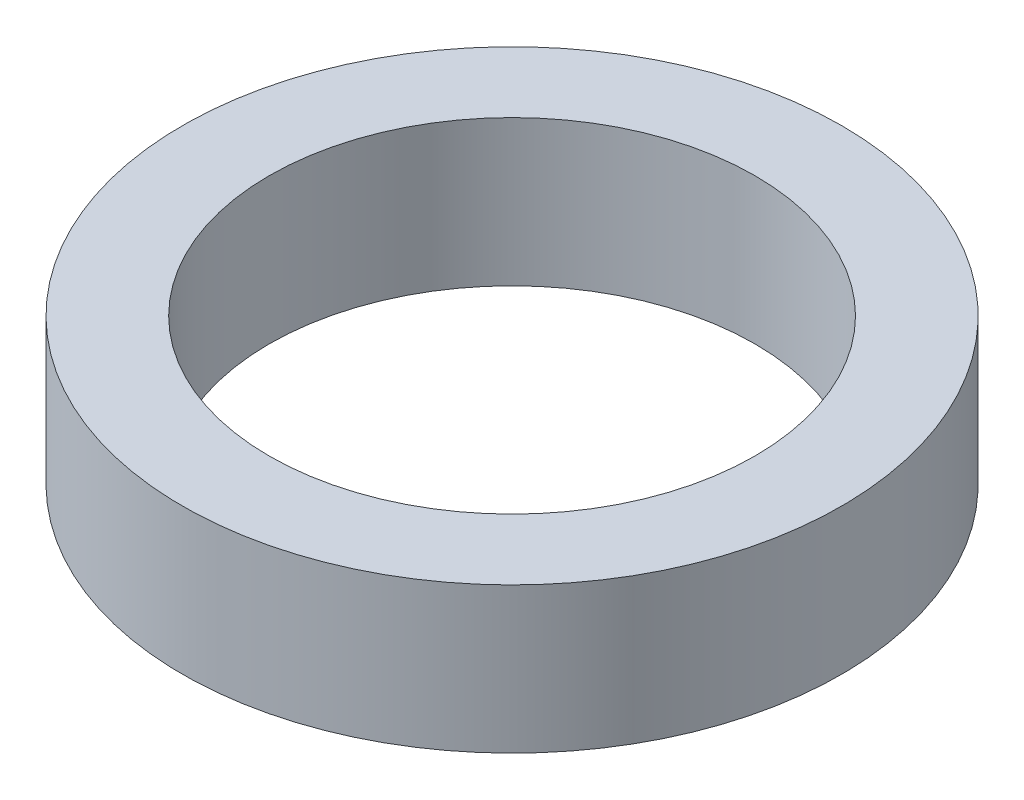
from build123d import *

# Parameters (mm, degrees)
SKETCH1_R           = 47.5
BOSS_EXTRUDE1_DEPTH = 21
SKETCH2_R           = 35
CUT_EXTRUDE1_DEPTH  = 71.381105419


with BuildPart() as part:
    # Sketch1 → Boss-Extrude1 (new body)
    with BuildSketch(Plane(origin=(0, 0, 0), x_dir=(1, 0, 0), z_dir=(0, 1, 0))):
        Circle(SKETCH1_R)
    extrude(amount=BOSS_EXTRUDE1_DEPTH)

    # Sketch2 → Cut-Extrude1 (cut, through all)
    with BuildSketch(Plane(origin=(0, 0, 0), x_dir=(1, 0, 0), z_dir=(0, 1, 0))):
        Circle(SKETCH2_R)
    extrude(amount=CUT_EXTRUDE1_DEPTH, mode=Mode.SUBTRACT)


solid = part.part
